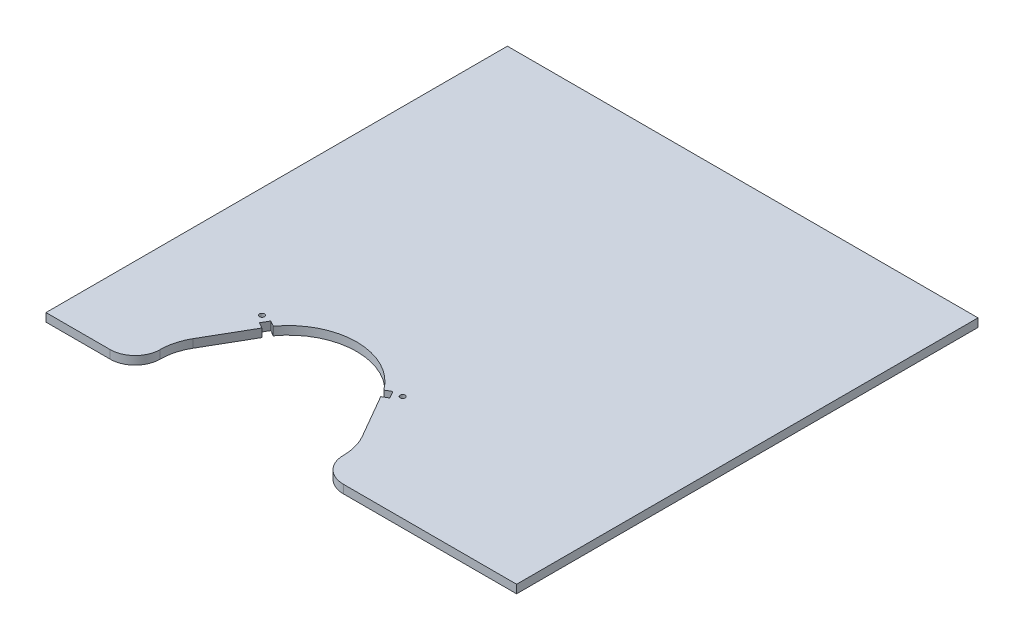
from build123d import *

# Parameters (mm, degrees)
ESQUISSE1_W             = 282.497861144
ESQUISSE1_H             = 276.982873123
BOSS_EXTRU_1_DEPTH      = 5
ESQUISSE2_R             = 1.5
ENL_V_MAT_EXTRU_2_DEPTH = 284.291382269


with BuildPart() as part:
    # Esquisse1 → Boss.-Extru.1 (new body)
    with BuildSketch(Plane(origin=(0, 0, 0), x_dir=(1, 0, 0), z_dir=(0, 1, 0))):
        with Locations((0.748930572, -106.591436562)):
            Rectangle(ESQUISSE1_W, ESQUISSE1_H)
    extrude(amount=BOSS_EXTRU_1_DEPTH)

    # Esquisse2 → Enlèv. mat.-Extru.2 (cut, through all)
    with BuildSketch(Plane(origin=(0, 0, 0), x_dir=(1, 0, 0), z_dir=(0, 1, 0))):
        with Locations((-74.225778058, -181.665063509)):
            Circle(ESQUISSE2_R)
        with Locations((10.225778058, -181.665063509)):
            Circle(ESQUISSE2_R)
        with BuildLine():
            Line((-65.181549424, -184), (-68.645651039, -182))
            Line((-68.645651039, -182), (-71.145651039, -186.330127019))
            Line((-71.145651039, -186.330127019), (-67.681549424, -188.330127019))
            Line((-67.681549424, -188.330127019), (-82.853895909, -214.609402001))
            ThreePointArc((-82.853895909, -214.609402001), (-85.945508514, -222.073215083), (-87, -230.082873123))
            ThreePointArc((-87, -230.082873123), (-91.393398282, -240.68947484), (-102, -245.082873123))
            Line((-102, -245.082873123), (38, -245.082873123))
            ThreePointArc((38, -245.082873123), (27.393398282, -240.68947484), (23, -230.082873123))
            ThreePointArc((23, -230.082873123), (21.945508514, -222.073215083), (18.853895909, -214.609402001))
            Line((18.853895909, -214.609402001), (3.681549424, -188.330127019))
            Line((3.681549424, -188.330127019), (7.145651039, -186.330127019))
            Line((7.145651039, -186.330127019), (4.645651039, -182))
            Line((4.645651039, -182), (1.181549424, -184))
            ThreePointArc((1.181549424, -184), (-32, -167.082873123), (-65.181549424, -184))
        make_face()
    extrude(amount=ENL_V_MAT_EXTRU_2_DEPTH, mode=Mode.SUBTRACT)


solid = part.part
